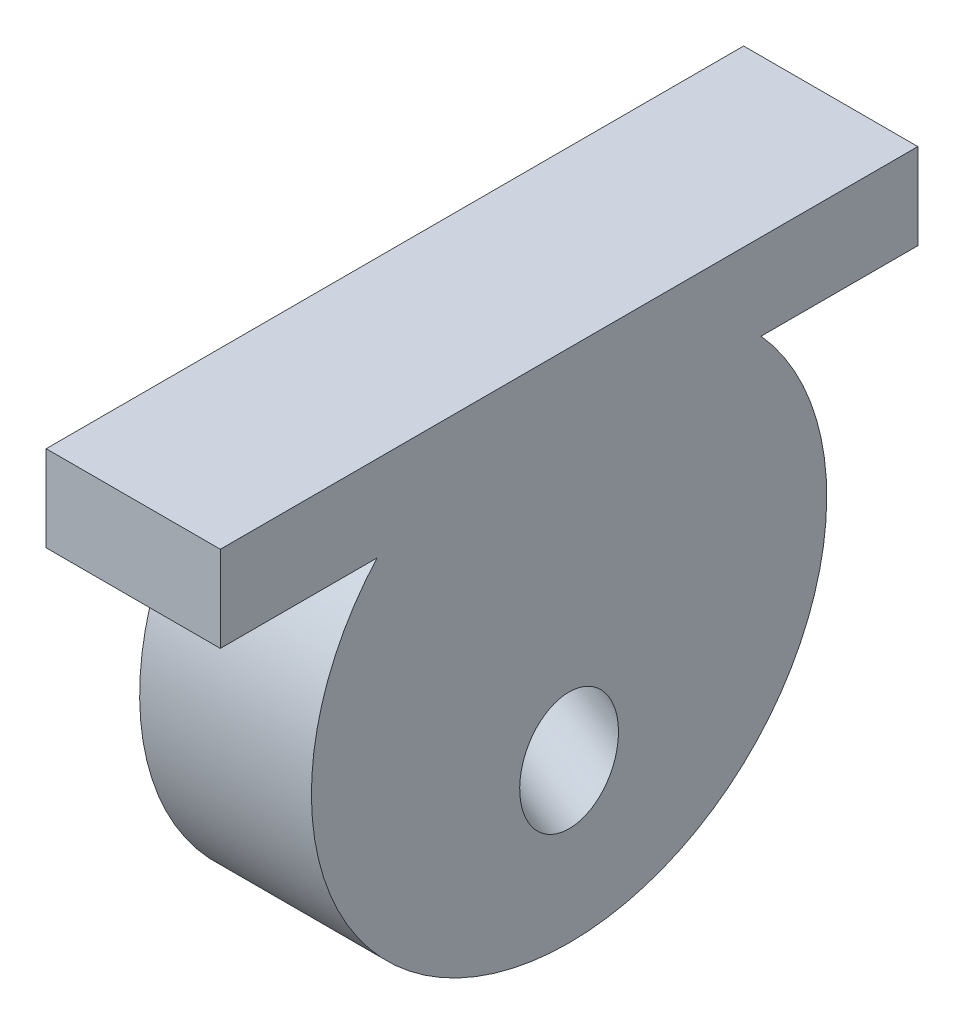
from build123d import *

# Parameters (mm, degrees)
SKETCH3_W            = 25.753050404
SKETCH3_H            = 103.137359271
BOSS_EXTRUDE1_DEPTH  = 12.7
SKETCH4_R            = 38.1
BOSS_EXTRUDE2_DEPTH  = 25.4
CUT_SWEEP1_PROFILE_R = 7.3025


with BuildPart() as part:
    # Sketch3 → Boss-Extrude1 (new body)
    with BuildSketch(Plane(origin=(0, 717.636591226, 0), x_dir=(-1, 0, 0), z_dir=(0, -1, 0))):
        with Locations((-511.2749233, -660.547915429)):
            Rectangle(SKETCH3_W, SKETCH3_H)
    extrude(amount=BOSS_EXTRUDE1_DEPTH)

    # Sketch4 → Boss-Extrude2 (add)
    with BuildSketch(Plane(origin=(524.151448502, 0, 0), x_dir=(0, 0, -1), z_dir=(1, 0, 0))):
        with Locations((-660.547915428, 679.536591226)):
            Circle(SKETCH4_R)
    extrude(amount=-BOSS_EXTRUDE2_DEPTH)

    # Cut-Sweep1: sweep along a curve in space
    with BuildLine() as cut_sweep1_path:
        Line((570.60857597, 634.0664872, 660.547915428), (477.694321033, 695.571618138, 660.547915428))
    # Cut-Sweep1 profile (on start of the path) → Cut-Sweep1 (sweep, cut)
    with BuildSketch(Plane(origin=(570.60857597, 634.0664872, 660.547915428), x_dir=(-0.5519777178096447, -0.8338588603844517, 0), z_dir=(-0.8338588603844517, 0.5519777178096447, 0))):
        Circle(CUT_SWEEP1_PROFILE_R)
    sweep(path=cut_sweep1_path.line, mode=Mode.SUBTRACT)


solid = part.part
